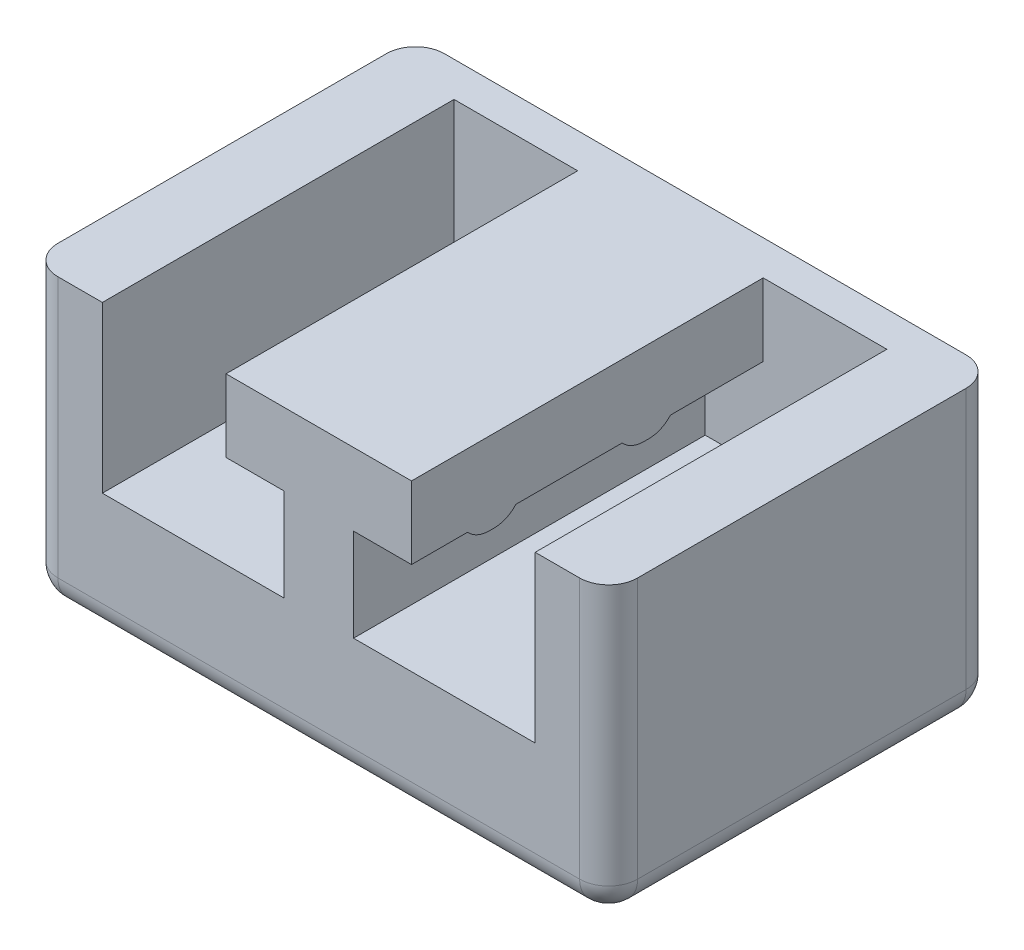
from build123d import *

# Parameters (mm, degrees)
SKETCH2_W            = 30
SKETCH2_H            = 20
BOSS_EXTRUDE1_DEPTH  = 15
CUT_EXTRUDE1_DEPTH   = 18.2
SKETCH4_W            = 2.5
SKETCH4_H            = 0.5
BOSS_EXTRUDE2_DEPTH  = 3
FILLET1_R            = 1.5
FILLET1_OF_MIRROR2_R = 1.5
FILLET2_R            = 1.5


with BuildPart() as part:
    # Sketch2 → Boss-Extrude1 (new body)
    with BuildSketch(Plane(origin=(0, 0, 0), x_dir=(1, 0, 0), z_dir=(0, 1, 0))):
        Rectangle(SKETCH2_W, SKETCH2_H)
    extrude(amount=BOSS_EXTRUDE1_DEPTH)

    # Sketch3 → Cut-Extrude1 (cut)
    with BuildSketch(Plane.XY.offset(10)):
        Polygon((-11.2, 15), (-11.2, 6.45), (-1.8, 6.45), (-1.8, 11.25), (-4.8, 11.25), (-4.8, 15), align=None)
    cut_extrude1 = extrude(amount=-CUT_EXTRUDE1_DEPTH, mode=Mode.SUBTRACT)

    # Sketch4 → Boss-Extrude2 (add)
    with BuildSketch(Plane.ZY.offset(1.8)):
        with Locations((5.85, 11)):
            Rectangle(SKETCH4_W, SKETCH4_H)
        with Locations((-2.15, 11)):
            Rectangle(SKETCH4_W, SKETCH4_H)
    boss_extrude2 = extrude(amount=BOSS_EXTRUDE2_DEPTH)

    # Fillet1
    # the kernel refuses this fillet: 1.5 mm, written as the material it takes off along each edge
    with BuildSketch(Plane(origin=(-1.8, 10.75, 4.6), x_dir=(0, 0, 1), z_dir=(-1, 0, 0)), Plane(origin=(-1.8, 10.75, -3.4), x_dir=(0, 0, 1), z_dir=(-1, 0, 0))) as fillet1_piece_1:
        with BuildLine():
            CenterArc((1.118033989, 1.5), FILLET1_R, 221.810314896, 48.189685104)
            Line((0, 0.5), (-0.02236068, 0.48))
            ThreePointArc((-0.02236068, 0.48), (-0.03, 0.25), (-0.03, 0))
            Line((-0.03, 0), (0, -0.03))
            Line((0, -0.03), (1.118033989, -0.03))
            Line((1.118033989, -0.03), (1.118033989, 0))
        make_face()
    extrude(amount=5.795084972, mode=Mode.SUBTRACT)
    with BuildSketch(Plane(origin=(-1.8, 10.75, 7.1), x_dir=(0, 1, 0), z_dir=(-1, 0, 0)), Plane(origin=(-1.8, 10.75, -0.9), x_dir=(0, 1, 0), z_dir=(-1, 0, 0))) as fillet1_piece_2:
        with BuildLine():
            CenterArc((1.5, 1.118033989), FILLET1_R, 180, 48.189685104)
            Line((0, 1.118033989), (-0.03, 1.118033989))
            Line((-0.03, 1.118033989), (-0.03, 0))
            Line((-0.03, 0), (0, -0.03))
            ThreePointArc((0, -0.03), (0.25, -0.03), (0.48, -0.02236068))
            Line((0.48, -0.02236068), (0.5, 0))
        make_face()
    extrude(amount=5.795084972, mode=Mode.SUBTRACT)

    # Mirror2: Cut-Extrude1, Boss-Extrude2 across plane
    add(cut_extrude1.mirror(Plane(origin=(0, 0, 0), x_dir=(0, 0, 1), z_dir=(1, 0, 0))), mode=Mode.SUBTRACT)
    add(boss_extrude2.mirror(Plane(origin=(0, 0, 0), x_dir=(0, 0, 1), z_dir=(1, 0, 0))))

    # Fillet1 of Mirror2
    # the kernel refuses this fillet: 1.5 mm, written as the material it takes off along each edge
    with BuildSketch(Plane(origin=(1.8, 10.75, 4.6), x_dir=(0, 0, 1), z_dir=(1, 0, 0)), Plane(origin=(1.8, 10.75, -3.4), x_dir=(0, 0, 1), z_dir=(1, 0, 0))) as fillet1_of_mirror2_piece_1:
        with BuildLine():
            CenterArc((1.118033989, -1.5), FILLET1_OF_MIRROR2_R, 90, 48.189685104)
            Line((0, -0.5), (-0.02236068, -0.48))
            ThreePointArc((-0.02236068, -0.48), (-0.03, -0.25), (-0.03, 0))
            Line((-0.03, 0), (0, 0.03))
            Line((0, 0.03), (1.118033989, 0.03))
            Line((1.118033989, 0.03), (1.118033989, 0))
        make_face()
    extrude(amount=5.795084972, mode=Mode.SUBTRACT)
    with BuildSketch(Plane(origin=(1.8, 10.75, 7.1), x_dir=(0, 1, 0), z_dir=(1, 0, 0)), Plane(origin=(1.8, 10.75, -0.9), x_dir=(0, 1, 0), z_dir=(1, 0, 0))) as fillet1_of_mirror2_piece_2:
        with BuildLine():
            CenterArc((1.5, -1.118033989), FILLET1_OF_MIRROR2_R, 131.810314896, 48.189685104)
            Line((0, -1.118033989), (-0.03, -1.118033989))
            Line((-0.03, -1.118033989), (-0.03, 0))
            Line((-0.03, 0), (0, 0.03))
            ThreePointArc((0, 0.03), (0.25, 0.03), (0.48, 0.02236068))
            Line((0.48, 0.02236068), (0.5, 0))
        make_face()
    extrude(amount=5.795084972, mode=Mode.SUBTRACT)

    # Fillet2
    fillet2_edges = [part.edges().sort_by_distance(p)[0] for p in [
        (0, 0, 10),
        (-15, 0, 0),
        (0, 0, -10),
        (15, 0, 0),
        (15, 7.5, 10),
        (-15, 7.5, 10),
        (-15, 7.5, -10),
        (15, 7.5, -10),
    ]]
    fillet(fillet2_edges, radius=FILLET2_R)


solid = part.part
